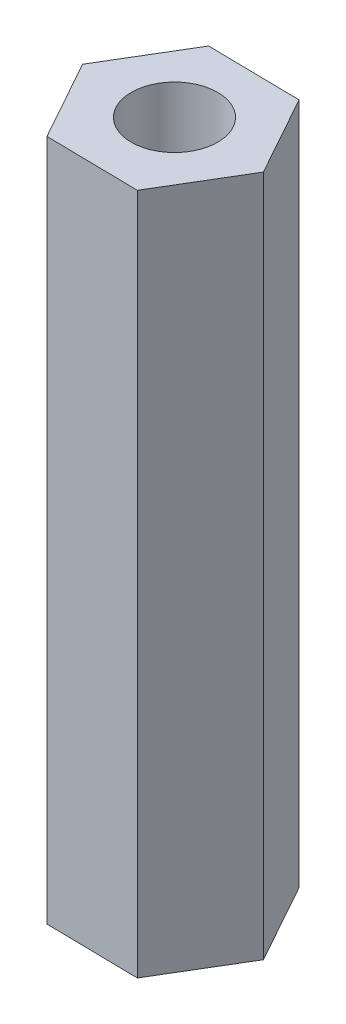
from build123d import *

# Parameters (mm, degrees)
SKETCH1_R           = 1.9
BOSS_EXTRUDE1_DEPTH = 30


with BuildPart() as part:
    # Sketch1 → Boss-Extrude1 (new body)
    with BuildSketch(Plane(origin=(0, 0, 0), x_dir=(1, 0, 0), z_dir=(0, 1, 0))):
        Polygon((1.964165255, -3.532051555), (4.040929001, -0.065008769), (2.076763746, 3.467042785), (-1.964165255, 3.532051555), (-4.040929001, 0.065008769), (-2.076763746, -3.467042785), align=None)
        with Locations((0, 0.065008769)):
            Circle(SKETCH1_R, mode=Mode.SUBTRACT)
    extrude(amount=BOSS_EXTRUDE1_DEPTH)


solid = part.part
